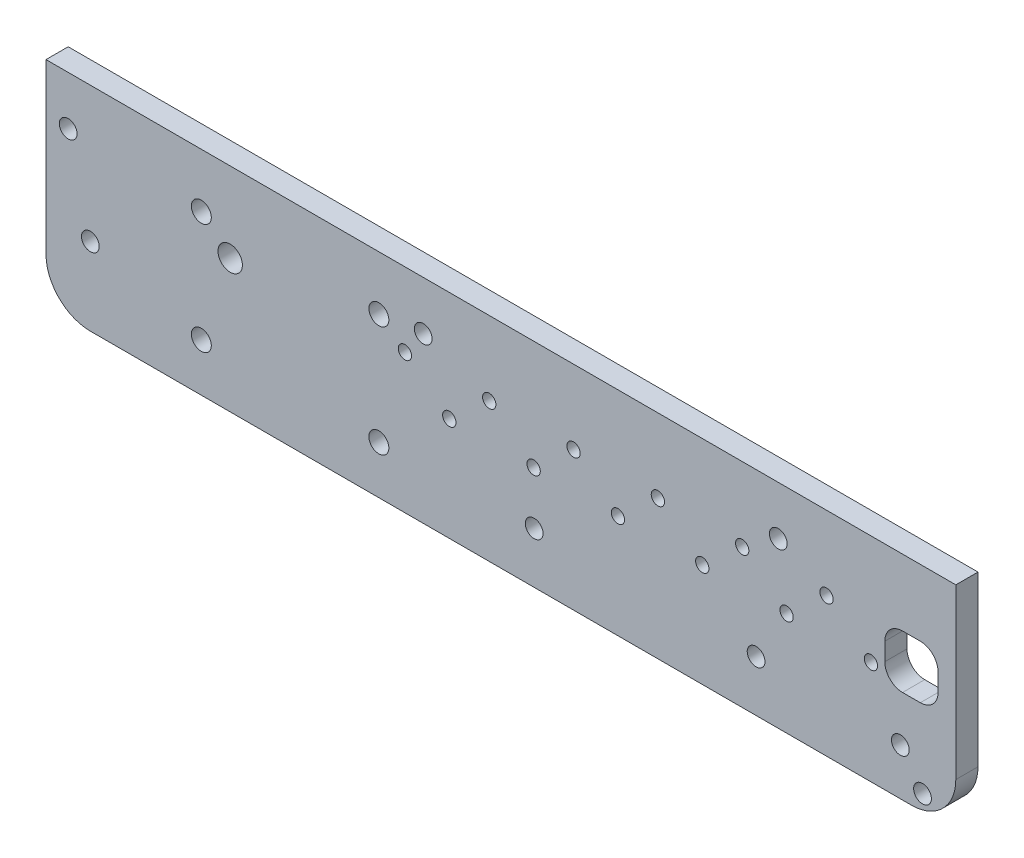
from build123d import *

# Parameters (mm, degrees)
SKETCH_1_R              = 2
EXTRUDE_1_DEPTH         = 5
SKETCH_2_R              = 2.75
SKETCH_2_R_2            = 2
SKETCH_2_R_3            = 2.25
CUT_EXTRUDE_1_DEPTH     = 12
CUT_EXTRUDE_2_OUTLINE_R = 1.5
CUT_EXTRUDE_2_DEPTH     = 5


# Read off the part's stored shape, not the designer's step: 切除-拉伸2
with BuildPart() as part:
    # 草图1 → 凸台-拉伸1 (new body)
    with BuildSketch(Plane.XY):
        with BuildLine():
            Line((-85, -0.312803354), (120, -0.312803354))
            Line((120, -0.312803354), (120, -38.312803354))
            ThreePointArc((120, -38.312803354), (117.071067812, -45.383871166), (110, -48.312803354))
            Line((110, -48.312803354), (-75, -48.312803354))
            ThreePointArc((-75, -48.312803354), (-82.071067812, -45.383871166), (-85, -38.312803354))
            Line((-85, -38.312803354), (-85, -0.312803354))
        make_face()
        with Locations((-80, -11.312803354)):
            Circle(SKETCH_1_R, mode=Mode.SUBTRACT)
        with Locations((0, -11.312803354)):
            Circle(SKETCH_1_R, mode=Mode.SUBTRACT)
        with Locations((80, -11.312803354)):
            Circle(SKETCH_1_R, mode=Mode.SUBTRACT)
        with Locations((75, -36.812803354)):
            Circle(SKETCH_1_R, mode=Mode.SUBTRACT)
        with Locations(Location((-75, -30.812803354, 0), (0, 0, 180))):
            Circle(SKETCH_1_R, mode=Mode.SUBTRACT)
        with Locations((25, -36.812803354)):
            Circle(SKETCH_1_R, mode=Mode.SUBTRACT)
    extrude(amount=EXTRUDE_1_DEPTH)

    # 草图2 → 切除-拉伸1 (cut)
    with BuildSketch(Plane.XY):
        with Locations(Location((-43.5, -18.312803354, 0), (0, 0, 180))):
            Circle(SKETCH_2_R)
        with Locations(Location((107.5, -37.812803354, 0), (0, 0, 180))):
            Circle(SKETCH_2_R_2)
        with Locations(Location((112.5, -44.812803354, 0), (0, 0, 180))):
            Circle(SKETCH_2_R_2)
        with Locations(Location((-50, -12.5, 0), (0, 0, 180))):
            Circle(SKETCH_2_R_3)
        with Locations(Location((-10, -12.5, 0), (0, 0, 180))):
            Circle(SKETCH_2_R_3)
        with Locations(Location((-50, -37.5, 0), (0, 0, 180))):
            Circle(SKETCH_2_R_3)
        with Locations(Location((-10, -37.5, 0), (0, 0, 180))):
            Circle(SKETCH_2_R_3)
        with BuildLine():
            Line((108, -15.312803354), (112, -15.312803354))
            ThreePointArc((112, -15.312803354), (114.828427125, -16.48437623), (116, -19.312803354))
            Line((116, -19.312803354), (116, -23.312803354))
            ThreePointArc((116, -23.312803354), (114.828427125, -26.141230479), (112, -27.312803354))
            Line((112, -27.312803354), (108, -27.312803354))
            ThreePointArc((108, -27.312803354), (105.171572875, -26.141230479), (104, -23.312803354))
            Line((104, -23.312803354), (104, -19.312803354))
            ThreePointArc((104, -19.312803354), (105.171572875, -16.48437623), (108, -15.312803354))
        make_face()
    extrude(amount=CUT_EXTRUDE_1_DEPTH, mode=Mode.SUBTRACT)

    # 切除-拉伸2 outline → 切除-拉伸2 (cut)
    with BuildSketch(Plane.XY):
        with Locations((100.870628671, -24.974954548)):
            Circle(CUT_EXTRUDE_2_OUTLINE_R)
        with Locations((90.870628671, -16.974954548)):
            Circle(CUT_EXTRUDE_2_OUTLINE_R)
        with Locations((81.870628671, -24.974954548)):
            Circle(CUT_EXTRUDE_2_OUTLINE_R)
        with Locations((71.870628671, -16.974954548)):
            Circle(CUT_EXTRUDE_2_OUTLINE_R)
        with Locations((62.870628671, -24.974954548)):
            Circle(CUT_EXTRUDE_2_OUTLINE_R)
        with Locations((52.870628671, -16.974954548)):
            Circle(CUT_EXTRUDE_2_OUTLINE_R)
        with Locations((43.870628671, -24.974954548)):
            Circle(CUT_EXTRUDE_2_OUTLINE_R)
        with Locations((33.870628671, -16.974954548)):
            Circle(CUT_EXTRUDE_2_OUTLINE_R)
        with Locations((24.870628671, -24.974954548)):
            Circle(CUT_EXTRUDE_2_OUTLINE_R)
        with Locations((14.870628671, -16.974954548)):
            Circle(CUT_EXTRUDE_2_OUTLINE_R)
        with Locations((5.870628671, -24.974954548)):
            Circle(CUT_EXTRUDE_2_OUTLINE_R)
        with Locations((-4.129371329, -16.974954548)):
            Circle(CUT_EXTRUDE_2_OUTLINE_R)
    extrude(amount=CUT_EXTRUDE_2_DEPTH, mode=Mode.SUBTRACT)


solid = part.part
